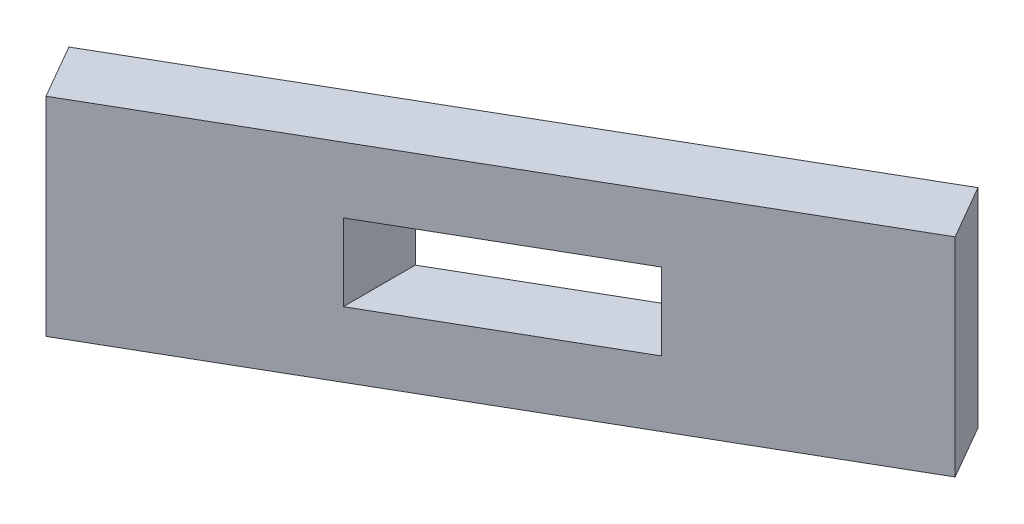
from build123d import *

# Parameters (mm, degrees)
EXTRUDE_1_DEPTH      = 5
EXTRUDE_1_DEPTH_BACK = 5
CUT_EXTRUDE_1_DEPTH  = 1.85


with BuildPart() as part:
    # 草圖1 → 填料-伸長1 (new, two sides: drawn at the far end of the back side and taken through both)
    with BuildSketch(Plane(origin=(0, 0, 0), x_dir=(1, 0, 0), z_dir=(0, 1, 0)).offset(-EXTRUDE_1_DEPTH_BACK)):
        Polygon((-24.417534462, -5.938079912), (-25.917534462, -3.340003701), (1.795278459, 12.659996299), (3.295278459, 10.061920088), align=None)
    extrude(amount=EXTRUDE_1_DEPTH + EXTRUDE_1_DEPTH_BACK)

    # 草圖2 → 除料-伸長1 (cut, symmetric)
    with BuildSketch(Plane(origin=(0, 0, 0), x_dir=(1, 0, 0), z_dir=(0, 1, 0))):
        Polygon((-15.35631853, 2.4), (-15.35631853, -0.706584455), (-5.65631853, 4.893713156), (-5.65631853, 8.357814772), (-15.35631853, 2.75751716), align=None)
    extrude(amount=CUT_EXTRUDE_1_DEPTH, both=True, mode=Mode.SUBTRACT)


solid = part.part
